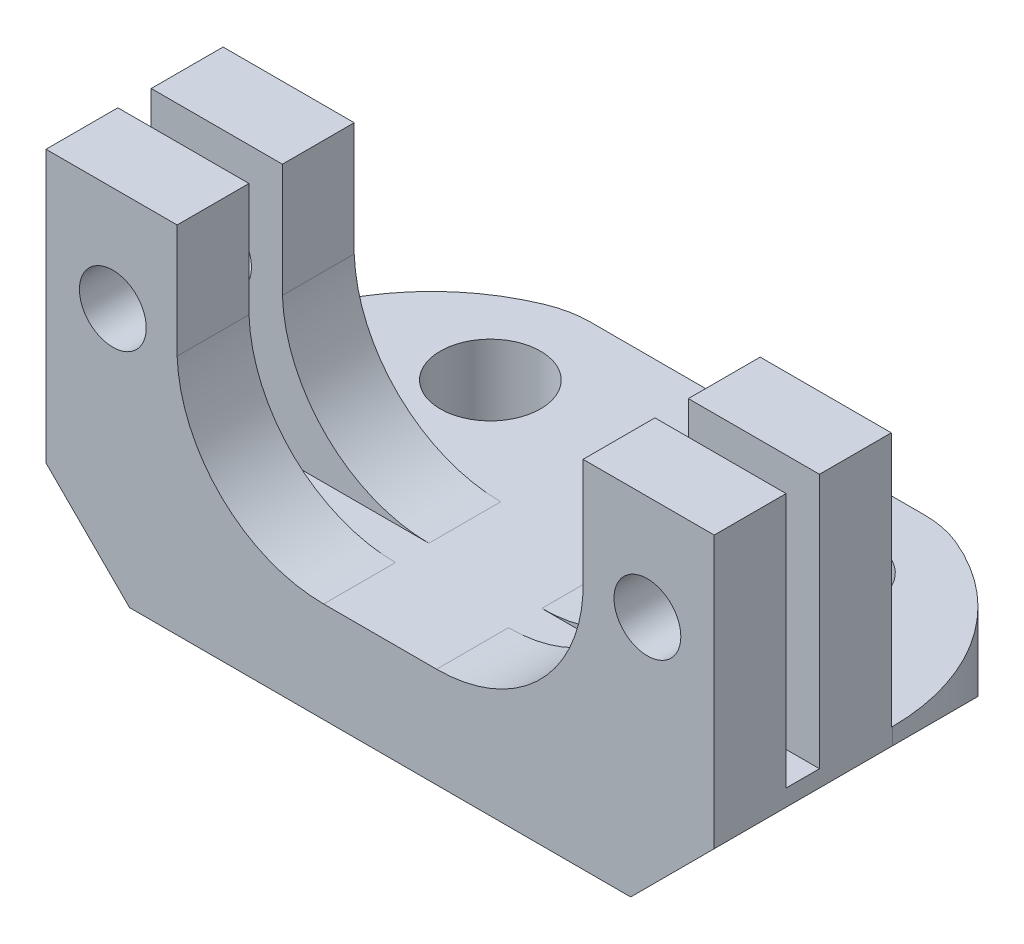
from build123d import *

# Parameters (mm, degrees)
SKETCH1_R           = 1
BOSS_EXTRUDE1_DEPTH = 5.3
SKETCH2_W           = 1
SKETCH2_H           = 7.632118098
CUT_EXTRUDE1_DEPTH  = 24.262242696
BOSS_EXTRUDE2_DEPTH = 6
SKETCH5_R           = 1.5
CUT_EXTRUDE2_DEPTH  = 14.937332122
CUT_EXTRUDE3_START  = -3
CUT_EXTRUDE3_DEPTH  = 3


# Read off the part's stored shape, not the designer's step: Cut-Extrude3
with BuildPart() as part:
    # Sketch1 → Boss-Extrude1 (new body)
    with BuildSketch(Plane.XY):
        with BuildLine():
            Line((-7.5, 0), (7.5, 0))
            Line((7.5, 0), (10, 2.5))
            Line((10, 2.5), (10, 10.632118098))
            Line((10, 10.632118098), (6.075, 10.632118098))
            Line((6.075, 10.632118098), (6.075, 7.547815402))
            ThreePointArc((6.075, 7.547815402), (4.848419821, 4.342215517), (1.689491671, 3))
            Line((1.689491671, 3), (-1.689458819, 3))
            ThreePointArc((-1.689458819, 3), (-4.736103523, 4.229921298), (-6.075, 7.230272374))
            Line((-6.075, 7.230272374), (-6.075, 10.632118098))
            Line((-6.075, 10.632118098), (-10, 10.632118098))
            Line((-10, 10.632118098), (-10, 2.5))
            Line((-10, 2.5), (-7.5, 0))
        make_face()
        with Locations((-8, 7.5)):
            Circle(SKETCH1_R, mode=Mode.SUBTRACT)
        with Locations((8, 7.5)):
            Circle(SKETCH1_R, mode=Mode.SUBTRACT)
    extrude(amount=BOSS_EXTRUDE1_DEPTH)

    # Sketch2 → Cut-Extrude1 (cut, through all)
    with BuildSketch(Plane(origin=(10, 0, 0), x_dir=(0, 0, -1), z_dir=(1, 0, 0))):
        with Locations((-2.65, 6.816059049)):
            Rectangle(SKETCH2_W, SKETCH2_H)
    extrude(amount=-CUT_EXTRUDE1_DEPTH, mode=Mode.SUBTRACT)

    # Sketch3 → Boss-Extrude2 (add)
    with BuildSketch(Plane(origin=(0, 0, 0), x_dir=(-1, 0, 0), z_dir=(0, 0, -1))):
        Polygon((10, 2.5), (10, 3), (1.689458819, 3), (-1.689491671, 3), (-10, 3), (-10, 2.5), (-7.5, 0), (7.5, 0), align=None)
    extrude(amount=BOSS_EXTRUDE2_DEPTH)

    # Sketch5 → Cut-Extrude2 (cut, through all)
    with BuildSketch(Plane(origin=(0, 3, 0), x_dir=(1, 0, 0), z_dir=(0, 1, 0))):
        with Locations(Location((-5, 3, 0), (0, 0, 270))):
            Circle(SKETCH5_R)
        with Locations(Location((5, 3, 0), (0, 0, 90))):
            Circle(SKETCH5_R)
    extrude(amount=-CUT_EXTRUDE2_DEPTH, mode=Mode.SUBTRACT)

    # Cut-Extrude3 outline → Cut-Extrude3 (cut)
    with BuildSketch(Plane(origin=(0, 3, 0), x_dir=(1, 0, 0), z_dir=(0, 1, 0)).offset(CUT_EXTRUDE3_START)):
        with BuildLine():
            ThreePointArc((-6.14052533, 5.774743587), (-5.581278436, 5.94314719), (-5, 6))
            Line((-5, 6), (-10, 6))
            Line((-10, 6), (-10, 0.031065848))
            ThreePointArc((-10, 0.031065848), (-8.941597101, 3.488399471), (-6.14052533, 5.774743587))
        make_face()
        with BuildLine():
            ThreePointArc((6.14052533, 5.774743587), (8.941597101, 3.488399471), (10, 0.031065848))
            Line((10, 0.031065848), (10, 6))
            Line((10, 6), (5, 6))
            ThreePointArc((5, 6), (5.581278436, 5.94314719), (6.14052533, 5.774743587))
        make_face()
    extrude(amount=CUT_EXTRUDE3_DEPTH, mode=Mode.SUBTRACT)


solid = part.part
